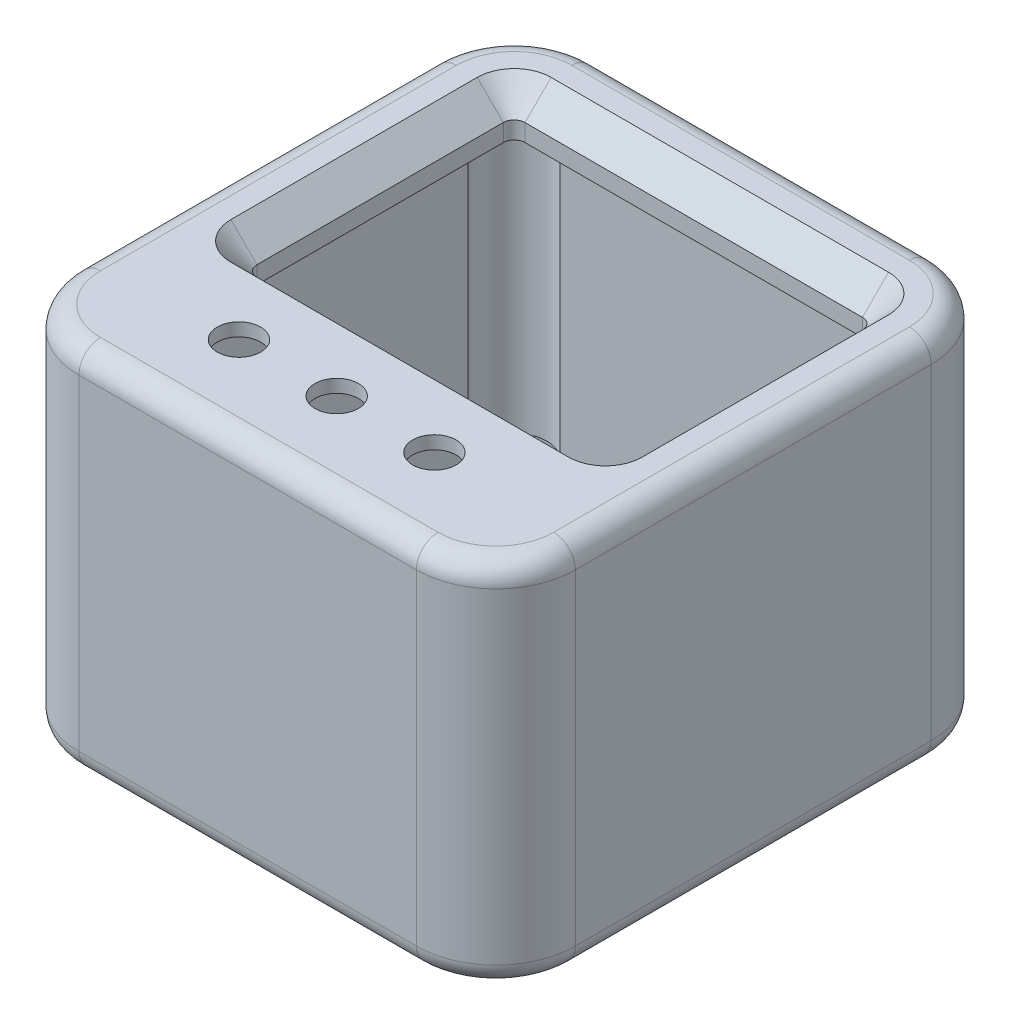
from build123d import *
from OCP.BRepFilletAPI import BRepFilletAPI_MakeChamfer

# Parameters (mm, degrees)
SKETCH_1_W            = 22.86
SKETCH_1_H            = 23.7
EXTRUDE_1_DEPTH       = 17
SKETCH_2_W            = 18.86
SKETCH_2_H            = 19.7
CUT_EXTRUDE_1_DEPTH   = 15
FILLET_1_R            = 3.66
SKETCH_3_R            = 1
CUT_EXTRUDE_2_DEPTH   = 24.665743174
SKETCH_4_W            = 16.54
SKETCH_4_H            = 12.34
CUT_EXTRUDE_3_DEPTH   = 24.665743174
FILLET_2_R            = 0.5
CHAMFER_1_SIZE        = 1.2
FILLET_3_R            = 1
CUT_EXTRUDE_4_DEPTH   = 2
SKETCH_6_R            = 1.5
CUT_EXTRUDE_5_R_DEPTH = 13
SKETCH_8_W            = 18.86
SKETCH_8_H            = 4.5
CUT_EXTRUDE_5_DEPTH   = 0.4
CUT_EXTRUDE_START     = -1
SKETCH_11_R           = 1
CUT_EXTRUDE_6_DEPTH   = 1
SKETCH_12_R           = 1.5
SKETCH_12_R_2         = 0.5
CUT_EXTRUDE_7_DEPTH   = 0.4
CHAMFER_2_SIZE        = 0.3
CHAMFER_2_SIZE_2      = 1


with BuildPart() as part:
    # 草图1 → 凸台-拉伸1 (new body)
    with BuildSketch(Plane(origin=(0, 0, 0), x_dir=(1, 0, 0), z_dir=(0, 1, 0))):
        Rectangle(SKETCH_1_W, SKETCH_1_H)
    extrude(amount=EXTRUDE_1_DEPTH)

    # 草图2 → 切除-拉伸1 (cut)
    with BuildSketch(Plane.XZ):
        Rectangle(SKETCH_2_W, SKETCH_2_H)
    extrude(amount=-CUT_EXTRUDE_1_DEPTH, mode=Mode.SUBTRACT)

    # 圆角1
    fillet_1_edges = [part.edges().sort_by_distance(p)[0] for p in [
        (11.43, 8.5, 11.85),
        (-11.43, 8.5, 11.85),
        (-11.43, 8.5, -11.85),
        (11.43, 8.5, -11.85),
    ]]
    fillet(fillet_1_edges, radius=FILLET_1_R)

    # 草图3 → 切除-拉伸2 (cut, through all)
    with BuildSketch(Plane(origin=(0, 17, 0), x_dir=(1, 0, 0), z_dir=(0, 1, 0))):
        with Locations(Location((0, -7.75, 0), (0, 0, 270))):
            Circle(SKETCH_3_R)
        with Locations(Location((4.5, -7.75, 0), (0, 0, 270))):
            Circle(SKETCH_3_R)
        with Locations(Location((-4.5, -7.75, 0), (0, 0, 270))):
            Circle(SKETCH_3_R)
    extrude(amount=-CUT_EXTRUDE_2_DEPTH, mode=Mode.SUBTRACT)

    # 草图4 → 切除-拉伸3 (cut, through all)
    with BuildSketch(Plane(origin=(0, 17, 0), x_dir=(1, 0, 0), z_dir=(0, 1, 0))):
        with Locations((0, 2.52)):
            Rectangle(SKETCH_4_W, SKETCH_4_H)
    extrude(amount=-CUT_EXTRUDE_3_DEPTH, mode=Mode.SUBTRACT)

    # 圆角2
    fillet_2_edges = [part.edges().sort_by_distance(p)[0] for p in [
        (-8.27, 16, -8.69),
        (8.27, 16, -8.69),
        (8.27, 16, 3.65),
        (-8.27, 16, 3.65),
    ]]
    fillet(fillet_2_edges, radius=FILLET_2_R)

    # 倒角1
    chamfer_1_edges = [part.edges().sort_by_distance(p)[0] for p in [
        (8.27, 17, -2.52),
        (0, 17, 3.65),
        (-8.27, 17, -2.52),
        (0, 17, -8.69),
        (8.123553391, 17, 3.503553391),
        (-8.123553391, 17, 3.503553391),
        (-8.123553391, 17, -8.543553391),
        (8.123553391, 17, -8.543553391),
    ]]
    chamfer(chamfer_1_edges, length=CHAMFER_1_SIZE)

    # 圆角3
    fillet_3_edges = [part.edges().sort_by_distance(p)[0] for p in [
        (0, 0, -11.85),
        (0, 17, -11.85),
        (11.43, 0, 0),
        (0, 0, 11.85),
        (-11.43, 0, 0),
        (-10.358010819, 0, 10.778010819),
        (10.358010819, 0, 10.778010819),
        (-10.358010819, 0, -10.778010819),
        (10.358010819, 0, -10.778010819),
        (11.43, 17, 0),
        (-11.43, 17, 0),
        (0, 17, 11.85),
        (-10.358010819, 17, 10.778010819),
        (10.358010819, 17, 10.778010819),
        (-10.358010819, 17, -10.778010819),
        (10.358010819, 17, -10.778010819),
    ]]
    fillet(fillet_3_edges, radius=FILLET_3_R)

    # 草图5 → 切除-拉伸4 (cut)
    with BuildSketch(Plane.XZ):
        with BuildLine():
            Line((-7.77, 10.537594514), (7.77, 10.537594514))
            ThreePointArc((7.77, 10.537594514), (9.43, 9.85), (10.117594514, 8.19))
            Line((10.117594514, 8.19), (10.117594514, -8.19))
            ThreePointArc((10.117594514, -8.19), (9.43, -9.85), (7.77, -10.537594514))
            Line((7.77, -10.537594514), (-7.77, -10.537594514))
            ThreePointArc((-7.77, -10.537594514), (-9.43, -9.85), (-10.117594514, -8.19))
            Line((-10.117594514, -8.19), (-10.117594514, 8.19))
            ThreePointArc((-10.117594514, 8.19), (-9.43, 9.85), (-7.77, 10.537594514))
        make_face()
    extrude(amount=-CUT_EXTRUDE_4_DEPTH, mode=Mode.SUBTRACT)

    # 草图6 → 切除-拉伸5_可根据铣刀经济半径修改R角 (cut)
    with BuildSketch(Plane.XZ.offset(-2)):
        with Locations((8.369339828, 8.789339828)):
            Circle(SKETCH_6_R)
        with Locations((8.369339828, -8.789339828)):
            Circle(SKETCH_6_R)
        with Locations((-8.369339828, -8.789339828)):
            Circle(SKETCH_6_R)
        with Locations((-8.369339828, 8.789339828)):
            Circle(SKETCH_6_R)
    extrude(amount=-CUT_EXTRUDE_5_R_DEPTH, mode=Mode.SUBTRACT)

    # 草图8 → 切除-拉伸5 (cut)
    with BuildSketch(Plane.XZ.offset(-15)):
        with Locations((0, 7.6)):
            Rectangle(SKETCH_8_W, SKETCH_8_H)
    extrude(amount=-CUT_EXTRUDE_5_DEPTH, mode=Mode.SUBTRACT)

    # 草图11 → 切除-拉伸6 (cut)
    # profile 1 of 6: a face of its own
    with BuildSketch(Plane.XZ.offset(-15.4).offset(CUT_EXTRUDE_START)):
        with BuildLine():
            Line((2.7, 6.45), (2.7, 9.05))
            ThreePointArc((2.7, 9.05), (2.846446609, 9.403553391), (3.2, 9.55))
            Line((3.2, 9.55), (5.8, 9.55))
            ThreePointArc((5.8, 9.55), (6.153553391, 9.403553391), (6.3, 9.05))
            Line((6.3, 9.05), (6.3, 6.45))
            ThreePointArc((6.3, 6.45), (6.153553391, 6.096446609), (5.8, 5.95))
            Line((5.8, 5.95), (3.2, 5.95))
            ThreePointArc((3.2, 5.95), (2.846446609, 6.096446609), (2.7, 6.45))
        make_face()
        with BuildLine():
            ThreePointArc((3.2, 9.45), (2.917157288, 9.332842712), (2.8, 9.05))
            Line((2.8, 9.05), (2.8, 6.45))
            ThreePointArc((2.8, 6.45), (2.917157288, 6.167157288), (3.2, 6.05))
            Line((3.2, 6.05), (5.8, 6.05))
            ThreePointArc((5.8, 6.05), (6.082842712, 6.167157288), (6.2, 6.45))
            Line((6.2, 6.45), (6.2, 9.05))
            ThreePointArc((6.2, 9.05), (6.082842712, 9.332842712), (5.8, 9.45))
            Line((5.8, 9.45), (3.2, 9.45))
        make_face(mode=Mode.SUBTRACT)
    # profile 2 of 6: a face of its own
    with BuildSketch(Plane.XZ.offset(-15.4).offset(CUT_EXTRUDE_START)):
        with BuildLine():
            Line((5.8, 9.45), (3.2, 9.45))
            ThreePointArc((3.2, 9.45), (2.917157288, 9.332842712), (2.8, 9.05))
            Line((2.8, 9.05), (2.8, 6.45))
            ThreePointArc((2.8, 6.45), (2.917157288, 6.167157288), (3.2, 6.05))
            Line((3.2, 6.05), (5.8, 6.05))
            ThreePointArc((5.8, 6.05), (6.082842712, 6.167157288), (6.2, 6.45))
            Line((6.2, 6.45), (6.2, 9.05))
            ThreePointArc((6.2, 9.05), (6.082842712, 9.332842712), (5.8, 9.45))
        make_face()
        with Locations(Location((4.5, 7.75, 0), (0, 0, 90))):
            Circle(SKETCH_11_R, mode=Mode.SUBTRACT)
    # profile 3 of 6: a face of its own
    with BuildSketch(Plane.XZ.offset(-15.4).offset(CUT_EXTRUDE_START)):
        with BuildLine():
            Line((-1.8, 6.45), (-1.8, 9.05))
            ThreePointArc((-1.8, 9.05), (-1.653553391, 9.403553391), (-1.3, 9.55))
            Line((-1.3, 9.55), (1.3, 9.55))
            ThreePointArc((1.3, 9.55), (1.653553391, 9.403553391), (1.8, 9.05))
            Line((1.8, 9.05), (1.8, 6.45))
            ThreePointArc((1.8, 6.45), (1.653553391, 6.096446609), (1.3, 5.95))
            Line((1.3, 5.95), (-1.3, 5.95))
            ThreePointArc((-1.3, 5.95), (-1.653553391, 6.096446609), (-1.8, 6.45))
        make_face()
        with BuildLine():
            ThreePointArc((-1.3, 9.45), (-1.582842712, 9.332842712), (-1.7, 9.05))
            Line((-1.7, 9.05), (-1.7, 6.45))
            ThreePointArc((-1.7, 6.45), (-1.582842712, 6.167157288), (-1.3, 6.05))
            Line((-1.3, 6.05), (1.3, 6.05))
            ThreePointArc((1.3, 6.05), (1.582842712, 6.167157288), (1.7, 6.45))
            Line((1.7, 6.45), (1.7, 9.05))
            ThreePointArc((1.7, 9.05), (1.582842712, 9.332842712), (1.3, 9.45))
            Line((1.3, 9.45), (-1.3, 9.45))
        make_face(mode=Mode.SUBTRACT)
    # profile 4 of 6: a face of its own
    with BuildSketch(Plane.XZ.offset(-15.4).offset(CUT_EXTRUDE_START)):
        with BuildLine():
            Line((1.3, 9.45), (-1.3, 9.45))
            ThreePointArc((-1.3, 9.45), (-1.582842712, 9.332842712), (-1.7, 9.05))
            Line((-1.7, 9.05), (-1.7, 6.45))
            ThreePointArc((-1.7, 6.45), (-1.582842712, 6.167157288), (-1.3, 6.05))
            Line((-1.3, 6.05), (1.3, 6.05))
            ThreePointArc((1.3, 6.05), (1.582842712, 6.167157288), (1.7, 6.45))
            Line((1.7, 6.45), (1.7, 9.05))
            ThreePointArc((1.7, 9.05), (1.582842712, 9.332842712), (1.3, 9.45))
        make_face()
        with Locations(Location((0, 7.75, 0), (0, 0, 90))):
            Circle(SKETCH_11_R, mode=Mode.SUBTRACT)
    # profile 5 of 6: a face of its own
    with BuildSketch(Plane.XZ.offset(-15.4).offset(CUT_EXTRUDE_START)):
        with BuildLine():
            Line((-2.7, 6.45), (-2.7, 9.05))
            ThreePointArc((-2.7, 9.05), (-2.846446609, 9.403553391), (-3.2, 9.55))
            Line((-3.2, 9.55), (-5.8, 9.55))
            ThreePointArc((-5.8, 9.55), (-6.153553391, 9.403553391), (-6.3, 9.05))
            Line((-6.3, 9.05), (-6.3, 6.45))
            ThreePointArc((-6.3, 6.45), (-6.153553391, 6.096446609), (-5.8, 5.95))
            Line((-5.8, 5.95), (-3.2, 5.95))
            ThreePointArc((-3.2, 5.95), (-2.846446609, 6.096446609), (-2.7, 6.45))
        make_face()
        with BuildLine():
            ThreePointArc((-2.8, 9.05), (-2.917157288, 9.332842712), (-3.2, 9.45))
            Line((-3.2, 9.45), (-5.8, 9.45))
            ThreePointArc((-5.8, 9.45), (-6.082842712, 9.332842712), (-6.2, 9.05))
            Line((-6.2, 9.05), (-6.2, 6.45))
            ThreePointArc((-6.2, 6.45), (-6.082842712, 6.167157288), (-5.8, 6.05))
            Line((-5.8, 6.05), (-3.2, 6.05))
            ThreePointArc((-3.2, 6.05), (-2.917157288, 6.167157288), (-2.8, 6.45))
            Line((-2.8, 6.45), (-2.8, 9.05))
        make_face(mode=Mode.SUBTRACT)
    # profile 6 of 6: a face of its own
    with BuildSketch(Plane.XZ.offset(-15.4).offset(CUT_EXTRUDE_START)):
        with BuildLine():
            Line((-2.8, 6.45), (-2.8, 9.05))
            ThreePointArc((-2.8, 9.05), (-2.917157288, 9.332842712), (-3.2, 9.45))
            Line((-3.2, 9.45), (-5.8, 9.45))
            ThreePointArc((-5.8, 9.45), (-6.082842712, 9.332842712), (-6.2, 9.05))
            Line((-6.2, 9.05), (-6.2, 6.45))
            ThreePointArc((-6.2, 6.45), (-6.082842712, 6.167157288), (-5.8, 6.05))
            Line((-5.8, 6.05), (-3.2, 6.05))
            ThreePointArc((-3.2, 6.05), (-2.917157288, 6.167157288), (-2.8, 6.45))
        make_face()
        with Locations(Location((-4.5, 7.75, 0), (0, 0, 90))):
            Circle(SKETCH_11_R, mode=Mode.SUBTRACT)
    extrude(amount=CUT_EXTRUDE_6_DEPTH, mode=Mode.SUBTRACT)

    # 草图12 → 切除-拉伸7 (cut)
    with BuildSketch(Plane.XZ.offset(-15)):
        with Locations((8.369339828, 8.789339828)):
            Circle(SKETCH_12_R)
        with Locations((-8.369339828, 8.789339828)):
            Circle(SKETCH_12_R)
        with Locations((8.93, 5.35)):
            Circle(SKETCH_12_R_2)
        with Locations((-8.93, 5.35)):
            Circle(SKETCH_12_R_2)
    extrude(amount=-CUT_EXTRUDE_7_DEPTH, mode=Mode.SUBTRACT)

    # 倒角2
    chamfer_2_edges_1 = [part.edges().sort_by_distance(p)[0] for p in [
        (6.153553391, 15.4, 9.403553391),
    ]]
    chamfer_2_side_1 = [part.faces().sort_by_distance(p)[0] for p in [
        (6.157796031, 15.4, 9.407796031),
    ]]
    chamfer_2_edges_2 = [part.edges().sort_by_distance(p)[0] for p in [
        (4.5, 15.4, 9.55),
    ]]
    chamfer_2_side_2 = [part.faces().sort_by_distance(p)[0] for p in [
        (4.5, 15.4, 9.556),
    ]]
    chamfer_2_edges_3 = [part.edges().sort_by_distance(p)[0] for p in [
        (6.3, 15.4, 7.75),
    ]]
    chamfer_2_side_3 = [part.faces().sort_by_distance(p)[0] for p in [
        (6.306, 15.4, 7.75),
    ]]
    chamfer_2_edges_4 = [part.edges().sort_by_distance(p)[0] for p in [
        (2.846446609, 15.4, 9.403553391),
    ]]
    chamfer_2_side_4 = [part.faces().sort_by_distance(p)[0] for p in [
        (2.842203969, 15.4, 9.407796031),
    ]]
    chamfer_2_edges_5 = [part.edges().sort_by_distance(p)[0] for p in [
        (6.153553391, 15.4, 6.096446609),
    ]]
    chamfer_2_side_5 = [part.faces().sort_by_distance(p)[0] for p in [
        (6.157796031, 15.4, 6.092203969),
    ]]
    chamfer_2_edges_6 = [part.edges().sort_by_distance(p)[0] for p in [
        (2.7, 15.4, 7.75),
    ]]
    chamfer_2_side_6 = [part.faces().sort_by_distance(p)[0] for p in [
        (2.694, 15.4, 7.75),
    ]]
    chamfer_2_edges_7 = [part.edges().sort_by_distance(p)[0] for p in [
        (4.5, 15.4, 5.95),
    ]]
    chamfer_2_side_7 = [part.faces().sort_by_distance(p)[0] for p in [
        (4.5, 15.4, 5.944),
    ]]
    chamfer_2_edges_8 = [part.edges().sort_by_distance(p)[0] for p in [
        (2.846446609, 15.4, 6.096446609),
    ]]
    chamfer_2_side_8 = [part.faces().sort_by_distance(p)[0] for p in [
        (2.846446609, 15.406, 6.096446609),
    ]]
    chamfer_2_edges_9 = [part.edges().sort_by_distance(p)[0] for p in [
        (1.653553391, 15.4, 9.403553391),
    ]]
    chamfer_2_side_9 = [part.faces().sort_by_distance(p)[0] for p in [
        (1.657796031, 15.4, 9.407796031),
    ]]
    chamfer_2_edges_10 = [part.edges().sort_by_distance(p)[0] for p in [
        (0, 15.4, 9.55),
    ]]
    chamfer_2_side_10 = [part.faces().sort_by_distance(p)[0] for p in [
        (0, 15.4, 9.556),
    ]]
    chamfer_2_edges_11 = [part.edges().sort_by_distance(p)[0] for p in [
        (1.8, 15.4, 7.75),
    ]]
    chamfer_2_side_11 = [part.faces().sort_by_distance(p)[0] for p in [
        (1.806, 15.4, 7.75),
    ]]
    chamfer_2_edges_12 = [part.edges().sort_by_distance(p)[0] for p in [
        (-1.653553391, 15.4, 9.403553391),
    ]]
    chamfer_2_side_12 = [part.faces().sort_by_distance(p)[0] for p in [
        (-1.657796031, 15.4, 9.407796031),
    ]]
    chamfer_2_edges_13 = [part.edges().sort_by_distance(p)[0] for p in [
        (1.653553391, 15.4, 6.096446609),
    ]]
    chamfer_2_side_13 = [part.faces().sort_by_distance(p)[0] for p in [
        (1.657796031, 15.4, 6.092203969),
    ]]
    chamfer_2_edges_14 = [part.edges().sort_by_distance(p)[0] for p in [
        (-1.8, 15.4, 7.75),
    ]]
    chamfer_2_side_14 = [part.faces().sort_by_distance(p)[0] for p in [
        (-1.806, 15.4, 7.75),
    ]]
    chamfer_2_edges_15 = [part.edges().sort_by_distance(p)[0] for p in [
        (0, 15.4, 5.95),
    ]]
    chamfer_2_side_15 = [part.faces().sort_by_distance(p)[0] for p in [
        (0, 15.4, 5.944),
    ]]
    chamfer_2_edges_16 = [part.edges().sort_by_distance(p)[0] for p in [
        (-1.653553391, 15.4, 6.096446609),
    ]]
    chamfer_2_side_16 = [part.faces().sort_by_distance(p)[0] for p in [
        (-1.657796031, 15.4, 6.092203969),
    ]]
    chamfer_2_edges_17 = [part.edges().sort_by_distance(p)[0] for p in [
        (-2.7, 15.4, 7.75),
    ]]
    chamfer_2_side_17 = [part.faces().sort_by_distance(p)[0] for p in [
        (-2.694, 15.4, 7.75),
    ]]
    chamfer_2_edges_18 = [part.edges().sort_by_distance(p)[0] for p in [
        (-2.846446609, 15.4, 6.096446609),
    ]]
    chamfer_2_side_18 = [part.faces().sort_by_distance(p)[0] for p in [
        (-2.842203969, 15.4, 6.092203969),
    ]]
    chamfer_2_edges_19 = [part.edges().sort_by_distance(p)[0] for p in [
        (-2.846446609, 15.4, 9.403553391),
    ]]
    chamfer_2_side_19 = [part.faces().sort_by_distance(p)[0] for p in [
        (-2.842203969, 15.4, 9.407796031),
    ]]
    chamfer_2_edges_20 = [part.edges().sort_by_distance(p)[0] for p in [
        (-4.5, 15.4, 5.95),
    ]]
    chamfer_2_side_20 = [part.faces().sort_by_distance(p)[0] for p in [
        (-4.5, 15.4, 5.944),
    ]]
    chamfer_2_edges_21 = [part.edges().sort_by_distance(p)[0] for p in [
        (-4.5, 15.4, 9.55),
    ]]
    chamfer_2_side_21 = [part.faces().sort_by_distance(p)[0] for p in [
        (-4.5, 15.4, 9.556),
    ]]
    chamfer_2_edges_22 = [part.edges().sort_by_distance(p)[0] for p in [
        (-6.153553391, 15.4, 6.096446609),
    ]]
    chamfer_2_side_22 = [part.faces().sort_by_distance(p)[0] for p in [
        (-6.157796031, 15.4, 6.092203969),
    ]]
    chamfer_2_edges_23 = [part.edges().sort_by_distance(p)[0] for p in [
        (-6.153553391, 15.4, 9.403553391),
    ]]
    chamfer_2_side_23 = [part.faces().sort_by_distance(p)[0] for p in [
        (-6.157796031, 15.4, 9.407796031),
    ]]
    chamfer_2_edges_24 = [part.edges().sort_by_distance(p)[0] for p in [
        (-6.3, 15.4, 7.75),
    ]]
    chamfer_2_side_24 = [part.faces().sort_by_distance(p)[0] for p in [
        (-6.306, 15.4, 7.75),
    ]]
    chamfer_2 = BRepFilletAPI_MakeChamfer(part.part.solid().wrapped)
    for e in chamfer_2_edges_1:
        chamfer_2.Add(CHAMFER_2_SIZE - 0.0001, CHAMFER_2_SIZE_2 - 0.0001, e.wrapped, chamfer_2_side_1[0].wrapped)
    for e in chamfer_2_edges_2:
        chamfer_2.Add(CHAMFER_2_SIZE - 0.0001, CHAMFER_2_SIZE_2 - 0.0001, e.wrapped, chamfer_2_side_2[0].wrapped)
    for e in chamfer_2_edges_3:
        chamfer_2.Add(CHAMFER_2_SIZE - 0.0001, CHAMFER_2_SIZE_2 - 0.0001, e.wrapped, chamfer_2_side_3[0].wrapped)
    for e in chamfer_2_edges_4:
        chamfer_2.Add(CHAMFER_2_SIZE - 0.0001, CHAMFER_2_SIZE_2 - 0.0001, e.wrapped, chamfer_2_side_4[0].wrapped)
    for e in chamfer_2_edges_5:
        chamfer_2.Add(CHAMFER_2_SIZE - 0.0001, CHAMFER_2_SIZE_2 - 0.0001, e.wrapped, chamfer_2_side_5[0].wrapped)
    for e in chamfer_2_edges_6:
        chamfer_2.Add(CHAMFER_2_SIZE - 0.0001, CHAMFER_2_SIZE_2 - 0.0001, e.wrapped, chamfer_2_side_6[0].wrapped)
    for e in chamfer_2_edges_7:
        chamfer_2.Add(CHAMFER_2_SIZE - 0.0001, CHAMFER_2_SIZE_2 - 0.0001, e.wrapped, chamfer_2_side_7[0].wrapped)
    for e in chamfer_2_edges_8:
        chamfer_2.Add(CHAMFER_2_SIZE_2 - 0.0001, CHAMFER_2_SIZE - 0.0001, e.wrapped, chamfer_2_side_8[0].wrapped)
    for e in chamfer_2_edges_9:
        chamfer_2.Add(CHAMFER_2_SIZE - 0.0001, CHAMFER_2_SIZE_2 - 0.0001, e.wrapped, chamfer_2_side_9[0].wrapped)
    for e in chamfer_2_edges_10:
        chamfer_2.Add(CHAMFER_2_SIZE - 0.0001, CHAMFER_2_SIZE_2 - 0.0001, e.wrapped, chamfer_2_side_10[0].wrapped)
    for e in chamfer_2_edges_11:
        chamfer_2.Add(CHAMFER_2_SIZE - 0.0001, CHAMFER_2_SIZE_2 - 0.0001, e.wrapped, chamfer_2_side_11[0].wrapped)
    for e in chamfer_2_edges_12:
        chamfer_2.Add(CHAMFER_2_SIZE - 0.0001, CHAMFER_2_SIZE_2 - 0.0001, e.wrapped, chamfer_2_side_12[0].wrapped)
    for e in chamfer_2_edges_13:
        chamfer_2.Add(CHAMFER_2_SIZE - 0.0001, CHAMFER_2_SIZE_2 - 0.0001, e.wrapped, chamfer_2_side_13[0].wrapped)
    for e in chamfer_2_edges_14:
        chamfer_2.Add(CHAMFER_2_SIZE - 0.0001, CHAMFER_2_SIZE_2 - 0.0001, e.wrapped, chamfer_2_side_14[0].wrapped)
    for e in chamfer_2_edges_15:
        chamfer_2.Add(CHAMFER_2_SIZE - 0.0001, CHAMFER_2_SIZE_2 - 0.0001, e.wrapped, chamfer_2_side_15[0].wrapped)
    for e in chamfer_2_edges_16:
        chamfer_2.Add(CHAMFER_2_SIZE - 0.0001, CHAMFER_2_SIZE_2 - 0.0001, e.wrapped, chamfer_2_side_16[0].wrapped)
    for e in chamfer_2_edges_17:
        chamfer_2.Add(CHAMFER_2_SIZE - 0.0001, CHAMFER_2_SIZE_2 - 0.0001, e.wrapped, chamfer_2_side_17[0].wrapped)
    for e in chamfer_2_edges_18:
        chamfer_2.Add(CHAMFER_2_SIZE - 0.0001, CHAMFER_2_SIZE_2 - 0.0001, e.wrapped, chamfer_2_side_18[0].wrapped)
    for e in chamfer_2_edges_19:
        chamfer_2.Add(CHAMFER_2_SIZE - 0.0001, CHAMFER_2_SIZE_2 - 0.0001, e.wrapped, chamfer_2_side_19[0].wrapped)
    for e in chamfer_2_edges_20:
        chamfer_2.Add(CHAMFER_2_SIZE - 0.0001, CHAMFER_2_SIZE_2 - 0.0001, e.wrapped, chamfer_2_side_20[0].wrapped)
    for e in chamfer_2_edges_21:
        chamfer_2.Add(CHAMFER_2_SIZE - 0.0001, CHAMFER_2_SIZE_2 - 0.0001, e.wrapped, chamfer_2_side_21[0].wrapped)
    for e in chamfer_2_edges_22:
        chamfer_2.Add(CHAMFER_2_SIZE - 0.0001, CHAMFER_2_SIZE_2 - 0.0001, e.wrapped, chamfer_2_side_22[0].wrapped)
    for e in chamfer_2_edges_23:
        chamfer_2.Add(CHAMFER_2_SIZE - 0.0001, CHAMFER_2_SIZE_2 - 0.0001, e.wrapped, chamfer_2_side_23[0].wrapped)
    for e in chamfer_2_edges_24:
        chamfer_2.Add(CHAMFER_2_SIZE - 0.0001, CHAMFER_2_SIZE_2 - 0.0001, e.wrapped, chamfer_2_side_24[0].wrapped)
    add(Compound.cast(chamfer_2.Shape()), mode=Mode.REPLACE)  # a hair under: the kernel refuses the full size


solid = part.part
